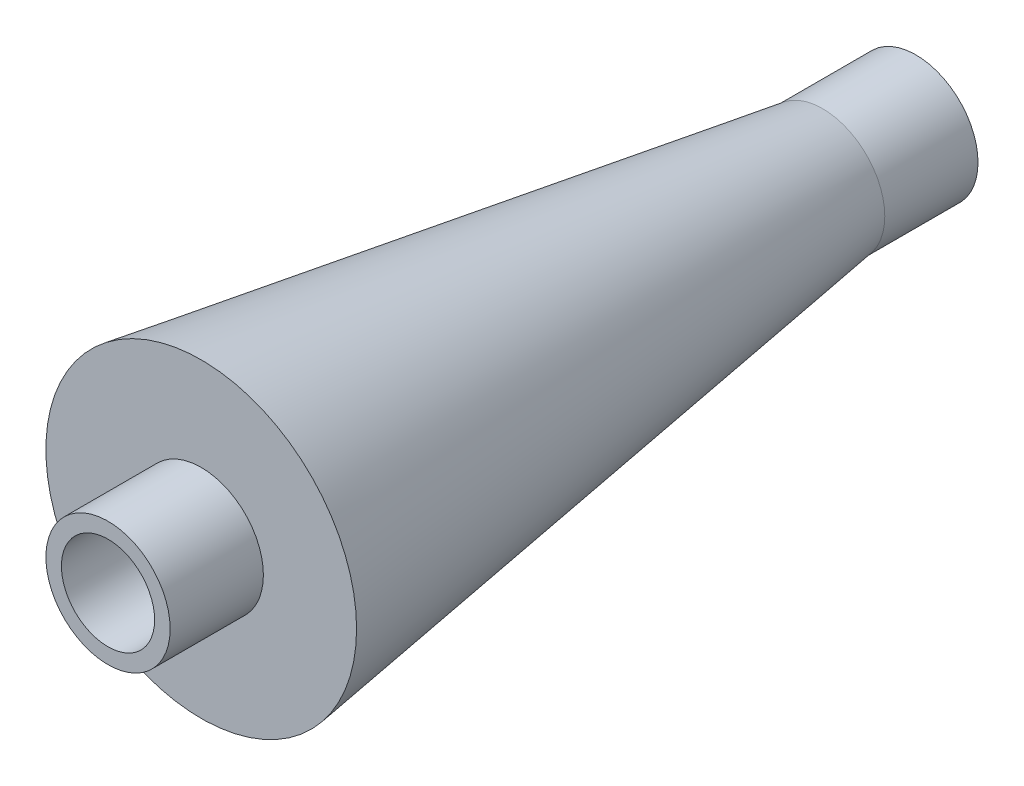
from build123d import *


with BuildPart() as part:
    # Sketch1 → Revolve1 (revolve)
    with BuildSketch(Plane(origin=(0, 0, 0), x_dir=(1, 0, 0), z_dir=(0, 1, 0))):
        Polygon((6.35, 9.525), (6.35, 19.05), (15.875, 19.05), (6.35, 82.55), (6.35, 92.075), (4.7625, 92.075), (4.7625, 9.525), align=None)
    revolve(axis=Axis((0, 0, 1.5875), (0, 0, -1)))


solid = part.part
